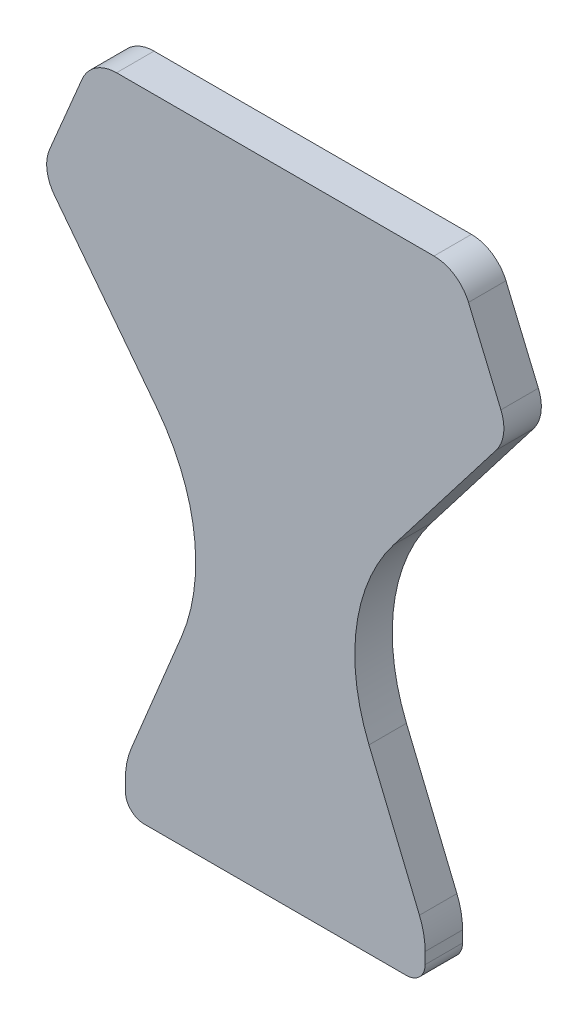
from build123d import *

# Parameters (mm, degrees)
EXTRUDE_1_DEPTH = 10
FILLET_4_R      = 50
FILLET_2_R      = 10
FILLET_3_R      = 5
FILLET_5_R      = 20


with BuildPart() as part:
    # 草图1 → 凸台-拉伸1 (new body)
    with BuildSketch(Plane.XY):
        Polygon((-49, 139.387438326), (49, 139.387438326), (62.5, 107.387438326), (14, 44.387438326), (40, -18.612561674), (40, -30.612561674), (-40, -30.612561674), (-40, -18.612561674), (-14, 44.387438326), (-62.5, 107.387438326), align=None)
    extrude(amount=EXTRUDE_1_DEPTH)

    # 圆角4
    fillet_4_edges = [part.edges().sort_by_distance(p)[0] for p in [
        (14, 44.387438326, 5),
        (-14, 44.387438326, 5),
    ]]
    fillet(fillet_4_edges, radius=FILLET_4_R)

    # 圆角2
    fillet_2_edges = [part.edges().sort_by_distance(p)[0] for p in [
        (-49, 139.387438326, 5),
        (49, 139.387438326, 5),
        (62.5, 107.387438326, 5),
        (-62.5, 107.387438326, 5),
    ]]
    fillet(fillet_2_edges, radius=FILLET_2_R)

    # 圆角3
    fillet_3_edges = [part.edges().sort_by_distance(p)[0] for p in [
        (40, -30.612561674, 5),
        (-40, -30.612561674, 5),
    ]]
    fillet(fillet_3_edges, radius=FILLET_3_R)

    # 圆角5
    fillet_5_edges = [part.edges().sort_by_distance(p)[0] for p in [
        (40, -18.612561674, 5),
        (-40, -18.612561674, 5),
    ]]
    fillet(fillet_5_edges, radius=FILLET_5_R)


solid = part.part
